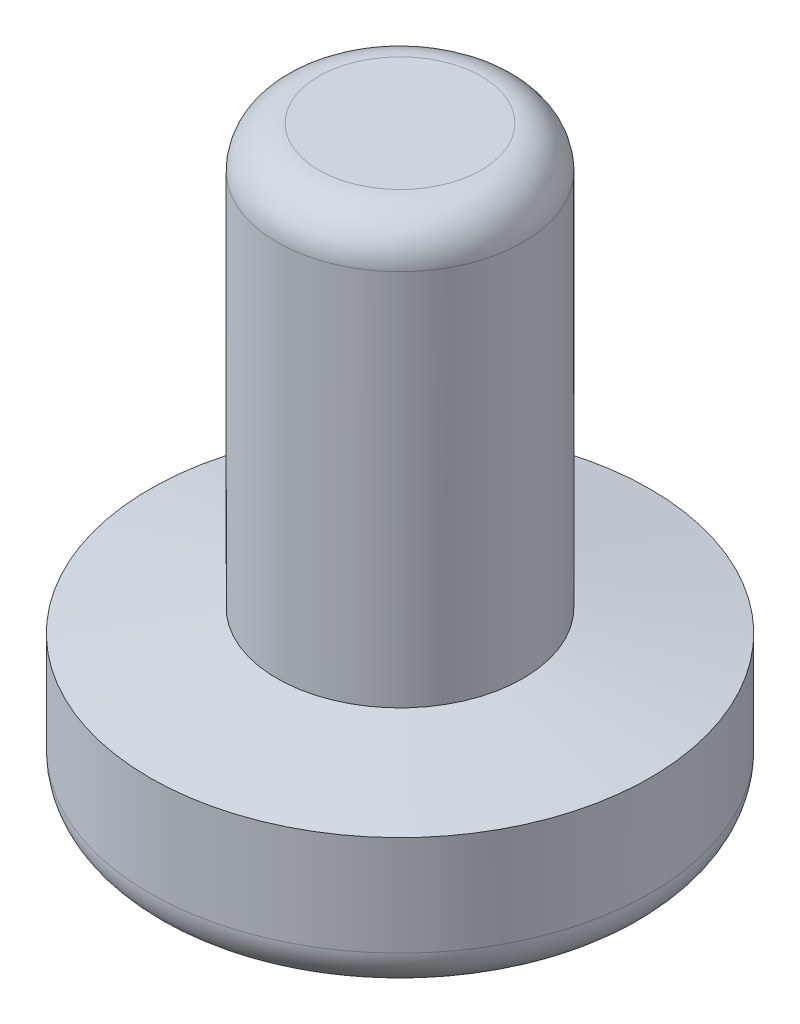
from build123d import *

# Parameters (mm, degrees)
CROQUIS1_R              = 3
SALIENTE_EXTRUIR1_DEPTH = 2
CROQUIS2_R              = 1.475
SALIENTE_EXTRUIR2_DEPTH = 5
CHAFL_N1_SIZE           = 0.3
CHAFL_N1_SIZE_2         = 1.701384546
REDONDEO1_R             = 0.5
REDONDEO2_R             = 0.5


with BuildPart() as part:
    # Croquis1 → Saliente-Extruir1 (new body)
    with BuildSketch(Plane(origin=(0, 0, 0), x_dir=(1, 0, 0), z_dir=(0, 1, 0))):
        with Locations(Location((0, 0, 0), (0, 0, 270))):
            Circle(CROQUIS1_R)
    extrude(amount=SALIENTE_EXTRUIR1_DEPTH)

    # Croquis2 → Saliente-Extruir2 (add)
    with BuildSketch(Plane(origin=(0, 2, 0), x_dir=(1, 0, 0), z_dir=(0, 1, 0))):
        with Locations(Location((0, 0, 0), (0, 0, 270))):
            Circle(CROQUIS2_R)
    extrude(amount=SALIENTE_EXTRUIR2_DEPTH)

    # Chaflán1
    # the kernel refuses this chamfer: 1.701384546, 0.3 mm, written as the material it takes off along each edge
    with BuildSketch(Plane(origin=(0, 2, 0), x_dir=(0, 0, 1), z_dir=(-1, 0, 0))) as chafl_n1_piece_1_section:
        Polygon((3, -CHAFL_N1_SIZE), (3 - CHAFL_N1_SIZE_2, 0), (3, 0), align=None)
    chafl_n1_piece_1 = revolve(axis=Axis((0, 2, 0), (0, 1, 0)), mode=Mode.PRIVATE)
    chafl_n1_piece_1 = chafl_n1_piece_1 - Plane(origin=(0, 1.84524898, 0), x_dir=(0, 0, 1), z_dir=(0, -1, 0)) * Cylinder(1.475, 12, mode=Mode.PRIVATE)
    add(chafl_n1_piece_1, mode=Mode.SUBTRACT)

    # Redondeo1
    redondeo1_edges = [part.edges().sort_by_distance(p)[0] for p in [
        (0, 7, -1.475),
    ]]
    fillet(redondeo1_edges, radius=REDONDEO1_R)

    # Redondeo2
    redondeo2_edges = [part.edges().sort_by_distance(p)[0] for p in [
        (0, 0, -3),
    ]]
    fillet(redondeo2_edges, radius=REDONDEO2_R)


solid = part.part
